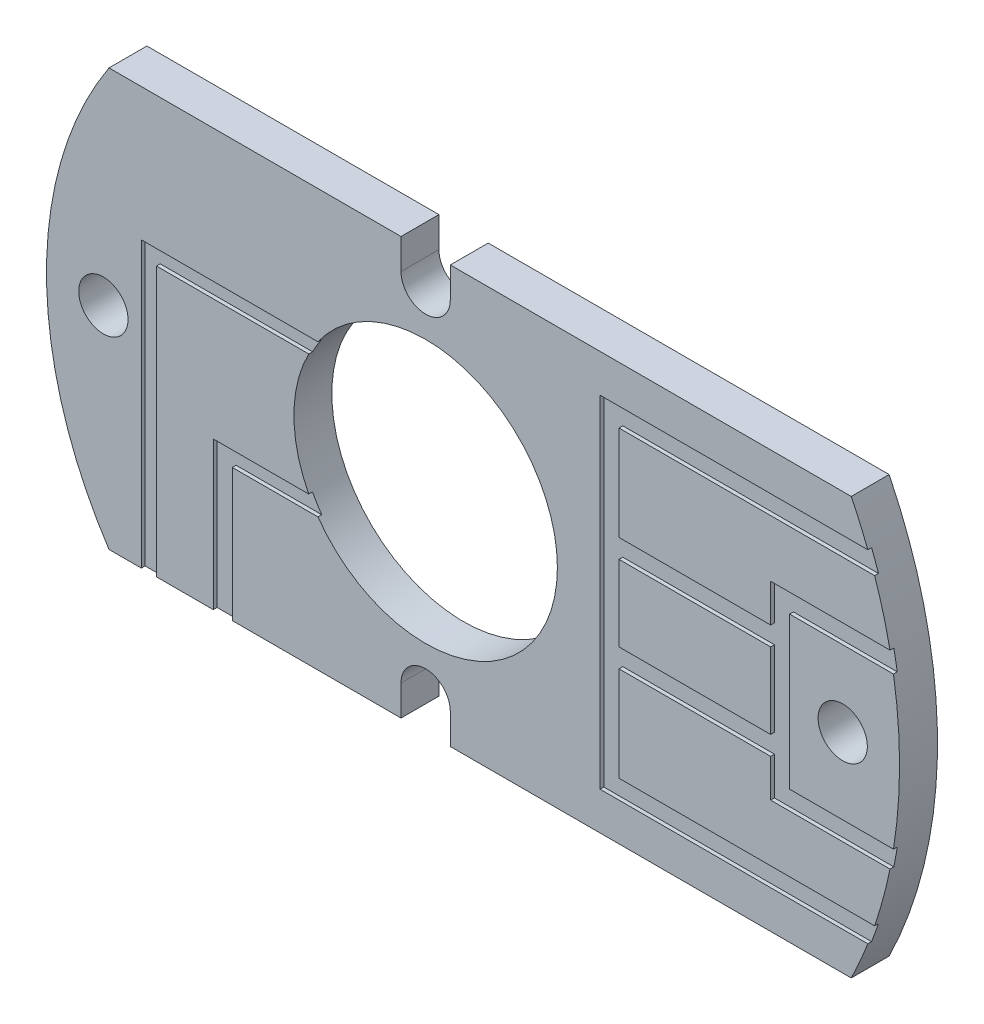
from build123d import *

# Parameters (mm, degrees)
MODEL_R             = 0.65
MODEL_R_2           = 3.4746057
EXTRUDE_1_DEPTH     = 0.5
EXTRUDE1_DEPTH      = 14.665650369
EXTRUDE1_DEPTH_BACK = 14.665650369
EXTRUDE2_START      = -0.1
SKETCH2_W           = 4
SKETCH2_H           = 2
EXTRUDE2_DEPTH      = 0.1


with BuildPart() as part:
    # Model → Бобышка-Вытянуть1 (new, symmetric)
    with BuildSketch(Plane.XY):
        with BuildLine():
            ThreePointArc((-0.65, -4.7), (0, -4.05), (0.65, -4.7))
            Line((0.65, -4.7), (0.65, -5.5))
            Line((0.65, -5.5), (12.5, -5.5))
            Line((12.5, -5.5), (12.5, 5.5))
            Line((12.5, 5.5), (0.65, 5.5))
            Line((0.65, 5.5), (0.65, 4.7))
            ThreePointArc((0.65, 4.7), (0, 4.05), (-0.65, 4.7))
            Line((-0.65, 4.7), (-0.65, 5.5))
            Line((-0.65, 5.5), (-10, 5.5))
            Line((-10, 5.5), (-10, -5.5))
            Line((-10, -5.5), (-0.65, -5.5))
            Line((-0.65, -5.5), (-0.65, -4.7))
        make_face()
        with Locations((-8.5, 0)):
            Circle(MODEL_R, mode=Mode.SUBTRACT)
        Circle(MODEL_R_2, mode=Mode.SUBTRACT)
        with Locations((11, 0)):
            Circle(MODEL_R, mode=Mode.SUBTRACT)
    extrude(amount=EXTRUDE_1_DEPTH, both=True)

    # Sketch1 → Extrude1 (cut, two sides: drawn at the far end of the back side and taken through both)
    with BuildSketch(Plane.XY.offset(-EXTRUDE1_DEPTH_BACK)):
        with BuildLine():
            Line((9.079883418, -9), (17.974504695, -9))
            Line((17.974504695, -9), (17.974504695, 9))
            Line((17.974504695, 9), (9.079883418, 9))
            Line((9.079883418, 9), (9.079883418, 8.591025382))
            ThreePointArc((9.079883418, 8.591025382), (12.5, 0), (9.079883418, -8.591025382))
            Line((9.079883418, -8.591025382), (9.079883418, -9))
        make_face()
        with BuildLine():
            ThreePointArc((-8.674675786, 9), (-12.5, 0), (-8.674675786, -9))
            Line((-8.674675786, -9), (-7.071790671, -9))
            Line((-7.071790671, -9), (-7.071790671, -7.070344879))
            ThreePointArc((-7.071790671, -7.070344879), (-10, 0), (-7.071790671, 7.070344879))
            Line((-7.071790671, 7.070344879), (-7.071790671, 9))
            Line((-7.071790671, 9), (-8.674675786, 9))
        make_face()
    extrude(amount=EXTRUDE1_DEPTH + EXTRUDE1_DEPTH_BACK, mode=Mode.SUBTRACT)

    # Sketch2 → Extrude2 (cut)
    # profile 1 of 3: a face of its own
    with BuildSketch(Plane.XY.offset(0.5).offset(EXTRUDE2_START)):
        with BuildLine():
            Line((-5.6, -5.5), (-5.1, -5.5))
            Line((-5.1, -5.5), (-5.1, -2))
            Line((-5.1, -2), (-2.841282241, -2))
            ThreePointArc((-2.841282241, -2), (-2.969532083, -1.804096444), (-3.084296479, -1.6))
            Line((-3.084296479, -1.6), (-5.6, -1.6))
            Line((-5.6, -1.6), (-5.6, -5.5))
        make_face()
    # profile 2 of 3: a face of its own
    with BuildSketch(Plane.XY.offset(0.5).offset(EXTRUDE2_START)):
        with BuildLine():
            Line((4.6, -4.5), (11.66190379, -4.5))
            ThreePointArc((11.66190379, -4.5), (11.754970287, -4.250961487), (11.842719282, -4))
            Line((11.842719282, -4), (5.1, -4))
            Line((5.1, -4), (5.1, -1.5))
            Line((5.1, -1.5), (9.1, -1.5))
            Line((9.1, -1.5), (9.1, -2.5))
            Line((9.1, -2.5), (12.247448714, -2.5))
            ThreePointArc((12.247448714, -2.5), (12.295747488, -2.250465219), (12.338962679, -2))
            Line((12.338962679, -2), (9.6, -2))
            Line((9.6, -2), (9.6, 2))
            Line((9.6, 2), (12.338962679, 2))
            ThreePointArc((12.338962679, 2), (12.295747488, 2.250465219), (12.247448714, 2.5))
            Line((12.247448714, 2.5), (9.1, 2.5))
            Line((9.1, 2.5), (9.1, 1.5))
            Line((9.1, 1.5), (5.1, 1.5))
            Line((5.1, 1.5), (5.1, 4))
            Line((5.1, 4), (11.842719282, 4))
            ThreePointArc((11.842719282, 4), (11.754970287, 4.250961487), (11.66190379, 4.5))
            Line((11.66190379, 4.5), (4.6, 4.5))
            Line((4.6, 4.5), (4.6, -4.5))
        make_face()
        with Locations((7.1, 0)):
            Rectangle(SKETCH2_W, SKETCH2_H, mode=Mode.SUBTRACT)
    # profile 3 of 3: a face of its own
    with BuildSketch(Plane.XY.offset(0.5).offset(EXTRUDE2_START)):
        with BuildLine():
            Line((-7.5, -5.5), (-7.1, -5.5))
            Line((-7.1, -5.5), (-7.1, 1.6))
            Line((-7.1, 1.6), (-3.084296479, 1.6))
            ThreePointArc((-3.084296479, 1.6), (-2.969532083, 1.804096444), (-2.841282241, 2))
            Line((-2.841282241, 2), (-7.5, 2))
            Line((-7.5, 2), (-7.5, -5.5))
        make_face()
    extrude(amount=EXTRUDE2_DEPTH, mode=Mode.SUBTRACT)


solid = part.part
